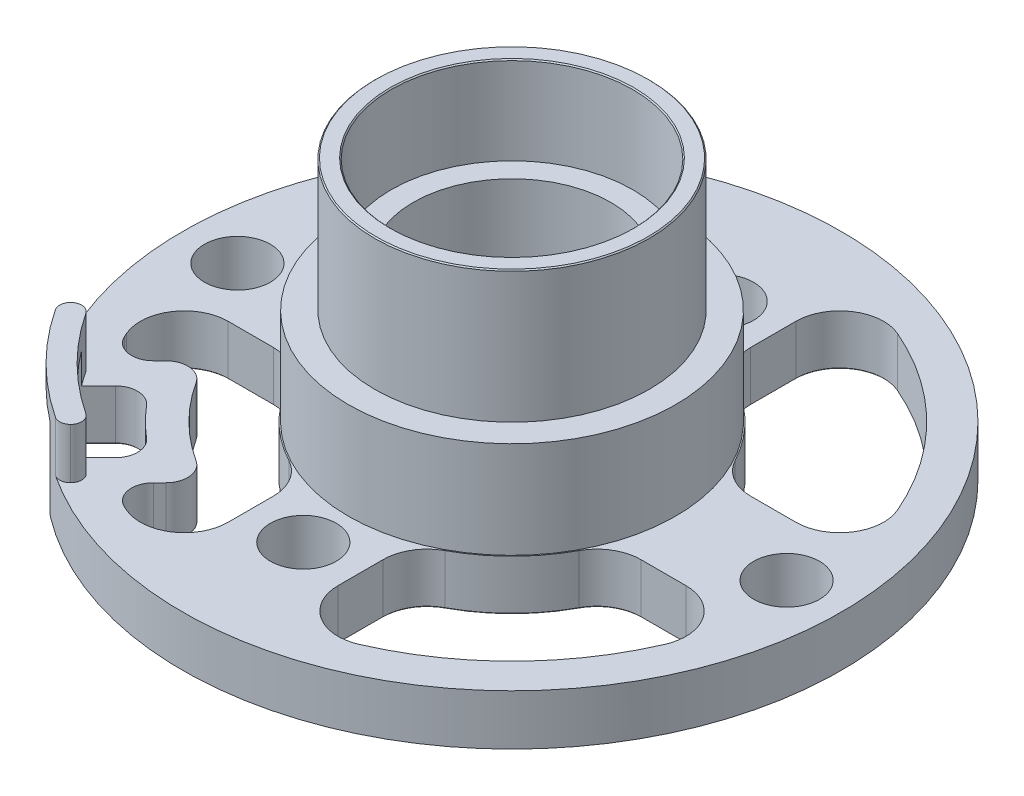
from build123d import *

# Parameters (mm, degrees)
SKETCH_1_R          = 15
EXTRUDE_1_DEPTH     = 2.3
SKETCH_2_R          = 1.5
CUT_EXTRUDE_1_DEPTH = 2.3
EXTRUDE_2_DEPTH     = 4.6
CUT_EXTRUDE_2_DEPTH = 3.7
CUT_EXTRUDE_START   = -2.3
CUT_EXTRUDE_3_DEPTH = 2.3
FILLET_1_R          = 1
SKETCH_6_R          = 7.45
EXTRUDE_3_DEPTH     = 4.4
SKETCH_7_R          = 6.25
EXTRUDE_4_DEPTH     = 6
SKETCH_8_R          = 5.5
CUT_EXTRUDE_4_DEPTH = 4
SKETCH_9_R          = 4.5
CUT_EXTRUDE_5_DEPTH = 25.724279565
CUT_EXTRUDE_START_2 = -4
SKETCH_10_R         = 5.5
CUT_EXTRUDE_6_DEPTH = 4
CHAMFER_1_SIZE      = 0.05
FILLET_2_R          = 0.5


with BuildPart() as part:
    # Эскиз1 → Бобышка-Вытянуть1 (new body)
    with BuildSketch(Plane(origin=(0, 0, 0), x_dir=(1, 0, 0), z_dir=(0, 1, 0))):
        with Locations(Location((0, 0, 0), (0, 0, 270))):
            Circle(SKETCH_1_R)
    extrude(amount=EXTRUDE_1_DEPTH)

    # Эскиз2 → Вырез-Вытянуть1 (cut)
    with BuildSketch(Plane.XZ):
        with BuildLine():
            ThreePointArc((-10.419812858, 2.5), (-12.091025454, 3.401342429), (-12.25590323, 5.292951542))
            ThreePointArc((-12.25590323, 5.292951542), (-9.439875529, 9.439875529), (-5.292951542, 12.25590323))
            ThreePointArc((-5.292951542, 12.25590323), (-3.401342429, 12.091025454), (-2.5, 10.419812858))
            Line((-2.5, 10.419812858), (-2.5, 8.366600265))
            ThreePointArc((-2.5, 8.366600265), (-2.783209849, 7.340621913), (-3.552631579, 6.605210736))
            ThreePointArc((-3.552631579, 6.605210736), (-5.303300859, 5.303300859), (-6.605210736, 3.552631579))
            ThreePointArc((-6.605210736, 3.552631579), (-7.340621913, 2.783209849), (-8.366600265, 2.5))
            Line((-8.366600265, 2.5), (-10.419812858, 2.5))
        make_face()
        with Locations(Location((0, 9.5, 0), (0, 0, 270))):
            Circle(SKETCH_2_R)
        with BuildLine():
            ThreePointArc((2.5, 10.419812858), (3.401342429, 12.091025454), (5.292951542, 12.25590323))
            ThreePointArc((5.292951542, 12.25590323), (9.439875529, 9.439875529), (12.25590323, 5.292951542))
            ThreePointArc((12.25590323, 5.292951542), (12.091025454, 3.401342429), (10.419812858, 2.5))
            Line((10.419812858, 2.5), (8.366600265, 2.5))
            ThreePointArc((8.366600265, 2.5), (7.340621913, 2.783209849), (6.605210736, 3.552631579))
            ThreePointArc((6.605210736, 3.552631579), (5.303300859, 5.303300859), (3.552631579, 6.605210736))
            ThreePointArc((3.552631579, 6.605210736), (2.783209849, 7.340621913), (2.5, 8.366600265))
            Line((2.5, 8.366600265), (2.5, 10.419812858))
        make_face()
        with Locations(Location((12.5, 0, 0), (0, 0, 270))):
            Circle(SKETCH_2_R)
        with BuildLine():
            ThreePointArc((10.419812858, -2.5), (12.091025454, -3.401342429), (12.25590323, -5.292951542))
            ThreePointArc((12.25590323, -5.292951542), (9.439875529, -9.439875529), (5.292951542, -12.25590323))
            ThreePointArc((5.292951542, -12.25590323), (3.401342429, -12.091025454), (2.5, -10.419812858))
            Line((2.5, -10.419812858), (2.5, -8.366600265))
            ThreePointArc((2.5, -8.366600265), (2.783209849, -7.340621913), (3.552631579, -6.605210736))
            ThreePointArc((3.552631579, -6.605210736), (5.303300859, -5.303300859), (6.605210736, -3.552631579))
            ThreePointArc((6.605210736, -3.552631579), (7.340621913, -2.783209849), (8.366600265, -2.5))
            Line((8.366600265, -2.5), (10.419812858, -2.5))
        make_face()
        with Locations(Location((0, -9.5, 0), (0, 0, 270))):
            Circle(SKETCH_2_R)
        with BuildLine():
            ThreePointArc((-2.5, -10.419812858), (-3.401342429, -12.091025454), (-5.292951542, -12.25590323))
            ThreePointArc((-5.292951542, -12.25590323), (-9.439875529, -9.439875529), (-12.25590323, -5.292951542))
            ThreePointArc((-12.25590323, -5.292951542), (-12.091025454, -3.401342429), (-10.419812858, -2.5))
            Line((-10.419812858, -2.5), (-8.366600265, -2.5))
            ThreePointArc((-8.366600265, -2.5), (-7.340621913, -2.783209849), (-6.605210736, -3.552631579))
            ThreePointArc((-6.605210736, -3.552631579), (-5.303300859, -5.303300859), (-3.552631579, -6.605210736))
            ThreePointArc((-3.552631579, -6.605210736), (-2.783209849, -7.340621913), (-2.5, -8.366600265))
            Line((-2.5, -8.366600265), (-2.5, -10.419812858))
        make_face()
        with Locations(Location((-12.5, 0, 0), (0, 0, 270))):
            Circle(SKETCH_2_R)
    extrude(amount=-CUT_EXTRUDE_1_DEPTH, mode=Mode.SUBTRACT)

    # Эскиз3 → Бобышка-Вытянуть2 (add)
    with BuildSketch(Plane.XZ):
        with BuildLine():
            Line((-5.476192266, 10.284518378), (-7.9263742, 12.734700312))
            ThreePointArc((-7.9263742, 12.734700312), (-10.606601718, 10.606601718), (-12.734700312, 7.9263742))
            Line((-12.734700312, 7.9263742), (-10.284518378, 5.476192266))
            ThreePointArc((-10.284518378, 5.476192266), (-9.471553651, 5.188917785), (-8.737287773, 5.640904394))
            ThreePointArc((-8.737287773, 5.640904394), (-7.353910524, 7.353910524), (-5.640904394, 8.737287773))
            ThreePointArc((-5.640904394, 8.737287773), (-5.188917785, 9.471553651), (-5.476192266, 10.284518378))
        make_face()
    extrude(amount=-EXTRUDE_2_DEPTH)

    # Эскиз4 → Вырез-Вытянуть2 (cut)
    with BuildSketch(Plane.XZ):
        with BuildLine():
            Line((-7.609089602, 10.437516727), (-11.362124092, 14.190551216))
            Line((-11.362124092, 14.190551216), (-14.190551216, 11.362124092))
            Line((-14.190551216, 11.362124092), (-10.437516727, 7.609089602))
            ThreePointArc((-10.437516727, 7.609089602), (-9.691317564, 7.316960783), (-8.970221669, 7.666493541))
            ThreePointArc((-8.970221669, 7.666493541), (-8.343860018, 8.343860018), (-7.666493541, 8.970221669))
            ThreePointArc((-7.666493541, 8.970221669), (-7.316960783, 9.691317564), (-7.609089602, 10.437516727))
        make_face()
    extrude(amount=-CUT_EXTRUDE_2_DEPTH, mode=Mode.SUBTRACT)

    # Эскиз5 → Вырез-Вытянуть3 (cut)
    with BuildSketch(Plane(origin=(0, 4.6, 0), x_dir=(1, 0, 0), z_dir=(0, 1, 0)).offset(CUT_EXTRUDE_START)):
        with BuildLine():
            Line((-12.937905898, -5.348886891), (-9.109525824, -3.766129051))
            Line((-9.109525824, -3.766129051), (-3.979530291, -8.038651188))
            Line((-3.979530291, -8.038651188), (-5.138314359, -13.022969152))
            ThreePointArc((-5.138314359, -13.022969152), (-9.818875666, -9.979462944), (-12.937905898, -5.348886891))
        make_face()
    extrude(amount=CUT_EXTRUDE_3_DEPTH, mode=Mode.SUBTRACT)

    # Скругление1
    fillet_1_edges = [part.edges().sort_by_distance(p)[0] for p in [
        (-11.532758238, 1.15, 6.724432126),
        (-6.724432126, 1.15, 11.532758238),
    ]]
    fillet(fillet_1_edges, radius=FILLET_1_R)

    # Эскиз6 → Бобышка-Вытянуть3 (add)
    with BuildSketch(Plane(origin=(0, 2.3, 0), x_dir=(1, 0, 0), z_dir=(0, 1, 0))):
        with Locations(Location((0, 0, 0), (0, 0, 270))):
            Circle(SKETCH_6_R)
    extrude(amount=EXTRUDE_3_DEPTH)

    # Эскиз7 → Бобышка-Вытянуть4 (add)
    with BuildSketch(Plane(origin=(0, 6.7, 0), x_dir=(1, 0, 0), z_dir=(0, 1, 0))):
        with Locations(Location((0, 0, 0), (0, 0, 270))):
            Circle(SKETCH_7_R)
    extrude(amount=EXTRUDE_4_DEPTH)

    # Эскиз8 → Вырез-Вытянуть4 (cut)
    with BuildSketch(Plane(origin=(0, 12.7, 0), x_dir=(1, 0, 0), z_dir=(0, 1, 0))):
        with Locations(Location((0, 0, 0), (0, 0, 270))):
            Circle(SKETCH_8_R)
    extrude(amount=-CUT_EXTRUDE_4_DEPTH, mode=Mode.SUBTRACT)

    # Эскиз9 → Вырез-Вытянуть5 (cut, through all)
    with BuildSketch(Plane.XZ):
        with Locations(Location((0, 0, 0), (0, 0, 270))):
            Circle(SKETCH_9_R)
    extrude(amount=-CUT_EXTRUDE_5_DEPTH, mode=Mode.SUBTRACT)

    # Эскиз10 → Вырез-Вытянуть6 (cut)
    with BuildSketch(Plane.XZ.offset(CUT_EXTRUDE_START_2)):
        with Locations(Location((0, 0, 0), (0, 0, 90))):
            Circle(SKETCH_10_R)
    extrude(amount=CUT_EXTRUDE_6_DEPTH, mode=Mode.SUBTRACT)

    # Фаска1
    chamfer_1_edges = [part.edges().sort_by_distance(p)[0] for p in [
        (-5.615881331, 0, 10.424207443),
        (-9.471553651, 0, 5.188917785),
        (-7.353910524, 0, 7.353910524),
        (-5.188917785, 0, 9.471553651),
        (-11.181814155, 0, 8.35338703),
        (-9.691317564, 0, 7.316960783),
        (-8.343860018, 0, 8.343860018),
        (-7.316960783, 0, 9.691317564),
        (-8.35338703, 0, 11.181814155),
        (-12.220045296, 0, 5.375220272),
        (-10.424207443, 0, 5.615881331),
        (-6.03192206, 0, 11.452137177),
        (-11.452137177, 0, 6.03192206),
        (0, 12.7, -6.25),
        (0, 12.7, -5.5),
        (0, 0, -5.5),
        (3.401342429, 0, 12.091025454),
        (7.340621913, 0, 2.783209849),
        (5.303300859, 0, 5.303300859),
        (2.5, 0, 9.393206562),
        (2.783209849, 0, 7.340621913),
        (9.393206562, 0, 2.5),
        (12.091025454, 0, 3.401342429),
        (9.439875529, 0, 9.439875529),
        (12.091025454, 0, -3.401342429),
        (2.5, 0, -9.393206562),
        (2.783209849, 0, -7.340621913),
        (5.303300859, 0, -5.303300859),
        (9.393206562, 0, -2.5),
        (7.340621913, 0, -2.783209849),
        (3.401342429, 0, -12.091025454),
        (9.439875529, 0, -9.439875529),
        (-3.401342429, 0, -12.091025454),
        (-9.393206562, 0, -2.5),
        (-7.340621913, 0, -2.783209849),
        (-5.303300859, 0, -5.303300859),
        (-2.5, 0, -9.393206562),
        (-2.783209849, 0, -7.340621913),
        (-12.091025454, 0, -3.401342429),
        (-9.439875529, 0, -9.439875529),
        (-12.091025454, 0, 3.401342429),
        (-2.783209849, 0, 7.340621913),
        (-5.303300859, 0, 5.303300859),
        (-9.393206562, 0, 2.5),
        (-7.340621913, 0, 2.783209849),
        (-2.5, 0, 9.393206562),
        (-3.401342429, 0, 12.091025454),
        (-5.375220272, 0, 12.220045296),
    ]]
    chamfer(chamfer_1_edges, length=CHAMFER_1_SIZE)

    # Скругление2
    fillet_2_edges = [part.edges().sort_by_distance(p)[0] for p in [
        (-7.9263742, 3.45, 12.734700312),
        (-7.198961436, 3.45, 12.007287548),
        (-12.734700312, 3.45, 7.9263742),
        (-12.007287548, 3.45, 7.198961436),
    ]]
    fillet(fillet_2_edges, radius=FILLET_2_R - 0.0001)  # a hair under: the kernel refuses the full size


solid = part.part
